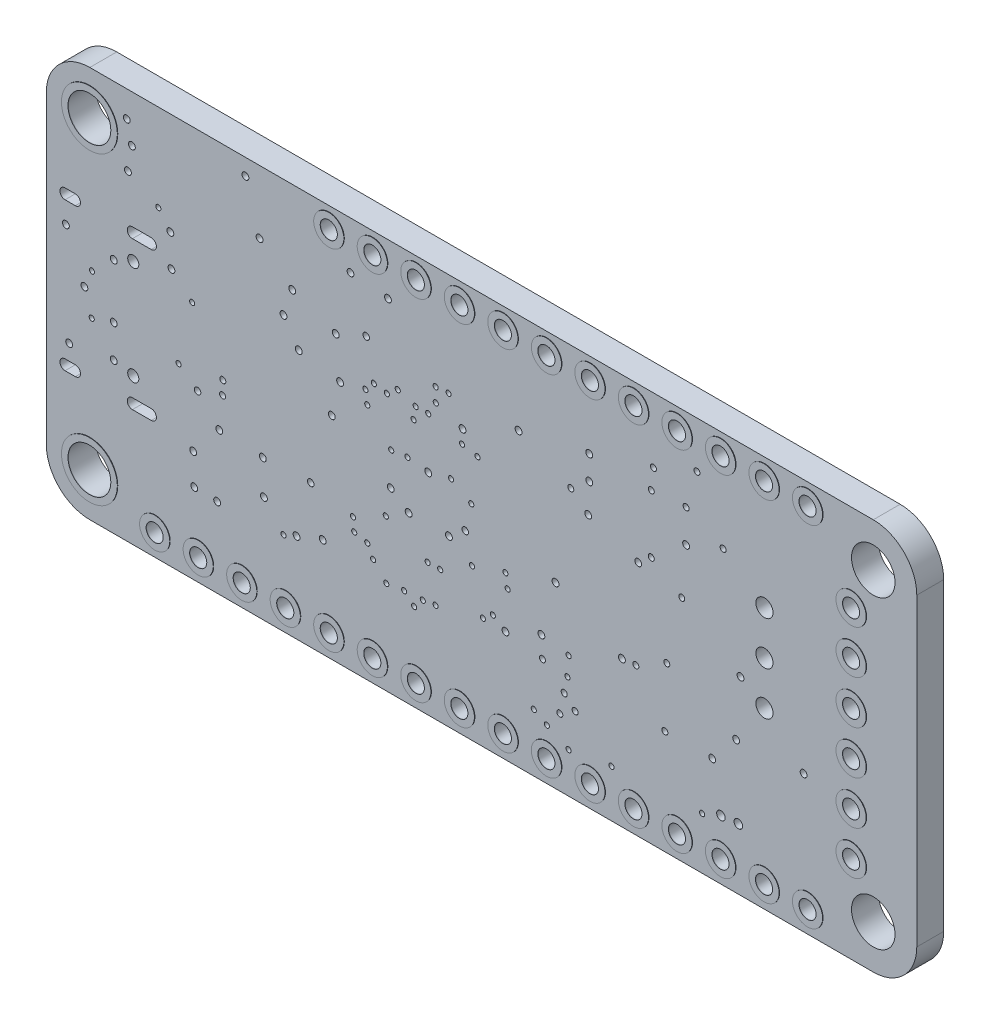
from build123d import *

# Parameters (mm, degrees)
SKETCH1_R              = 1.27
SKETCH1_R_2            = 0.5
SKETCH1_R_3            = 0.325
SKETCH1_R_4            = 1.25
SKETCH1_R_5            = 0.175
SKETCH1_R_6            = 0.15
SKETCH1_R_7            = 0.197
SKETCH1_R_8            = 0.1905
SKETCH1_R_9            = 0.2
SKETCH1_R_10           = 0.25
BOSS_EXTRUDE1_DEPTH    = 1.57
SKETCH2_R              = 0.881
SKETCH2_R_2            = 0.5
BOSS_EXTRUDE2_DEPTH    = 0.0254
BOSS_EXTRUDE2_2_DEPTH  = 0.0254
BOSS_EXTRUDE2_3_DEPTH  = 0.0254
BOSS_EXTRUDE2_4_DEPTH  = 0.0254
BOSS_EXTRUDE2_5_DEPTH  = 0.0254
BOSS_EXTRUDE2_6_DEPTH  = 0.0254
BOSS_EXTRUDE2_7_DEPTH  = 0.0254
BOSS_EXTRUDE2_8_DEPTH  = 0.0254
BOSS_EXTRUDE2_9_DEPTH  = 0.0254
BOSS_EXTRUDE2_10_DEPTH = 0.0254
BOSS_EXTRUDE2_11_DEPTH = 0.0254
BOSS_EXTRUDE2_12_DEPTH = 0.0254
BOSS_EXTRUDE2_13_DEPTH = 0.0254
BOSS_EXTRUDE2_14_DEPTH = 0.0254
BOSS_EXTRUDE2_15_DEPTH = 0.0254
BOSS_EXTRUDE2_16_DEPTH = 0.0254
BOSS_EXTRUDE2_17_DEPTH = 0.0254
BOSS_EXTRUDE2_18_DEPTH = 0.0254
BOSS_EXTRUDE2_19_DEPTH = 0.0254
BOSS_EXTRUDE2_20_DEPTH = 0.0254
BOSS_EXTRUDE2_21_DEPTH = 0.0254
BOSS_EXTRUDE2_22_DEPTH = 0.0254
BOSS_EXTRUDE2_23_DEPTH = 0.0254
BOSS_EXTRUDE2_24_DEPTH = 0.0254
BOSS_EXTRUDE2_25_DEPTH = 0.0254
BOSS_EXTRUDE2_26_DEPTH = 0.0254
BOSS_EXTRUDE2_27_DEPTH = 0.0254
BOSS_EXTRUDE2_28_DEPTH = 0.0254
BOSS_EXTRUDE2_29_DEPTH = 0.0254
BOSS_EXTRUDE2_30_DEPTH = 0.0254
BOSS_EXTRUDE2_31_DEPTH = 0.0254
BOSS_EXTRUDE2_32_DEPTH = 0.0254
BOSS_EXTRUDE2_33_DEPTH = 0.0254
BOSS_EXTRUDE2_34_DEPTH = 0.0254
SKETCH2_R_3            = 1.631
SKETCH2_R_4            = 1.25
BOSS_EXTRUDE2_35_DEPTH = 0.0254
BOSS_EXTRUDE2_36_DEPTH = 0.0254


with BuildPart() as part:
    # Sketch1 → Boss-Extrude1 (new body)
    with BuildSketch(Plane(origin=(0, 0, 0), x_dir=(-1, 0, 0), z_dir=(0, 0, -1))):
        with BuildLine():
            Line((0, 2.54), (0, 20.32))
            ThreePointArc((0, 20.32), (-0.743948776, 22.116051224), (-2.54, 22.86))
            Line((-2.54, 22.86), (-48.26, 22.86))
            ThreePointArc((-48.26, 22.86), (-50.056051224, 22.116051224), (-50.8, 20.32))
            Line((-50.8, 20.32), (-50.8, 2.54))
            ThreePointArc((-50.8, 2.54), (-50.056051224, 0.743948776), (-48.26, 0))
            Line((-48.26, 0), (-2.54, 0))
            ThreePointArc((-2.54, 0), (-0.743948776, 0.743948776), (0, 2.54))
        make_face()
        with Locations((-48.26, 2.54)):
            Circle(SKETCH1_R, mode=Mode.SUBTRACT)
        with Locations((-48.26, 20.32)):
            Circle(SKETCH1_R, mode=Mode.SUBTRACT)
        with Locations((-41.91, 15.24)):
            Circle(SKETCH1_R_2, mode=Mode.SUBTRACT)
        with Locations((-41.91, 10.16)):
            Circle(SKETCH1_R_2, mode=Mode.SUBTRACT)
        with Locations((-46.99, 7.62)):
            Circle(SKETCH1_R_2, mode=Mode.SUBTRACT)
        with Locations((-46.99, 12.7)):
            Circle(SKETCH1_R_2, mode=Mode.SUBTRACT)
        with Locations((-46.99, 17.78)):
            Circle(SKETCH1_R_2, mode=Mode.SUBTRACT)
        with Locations((-5.074, 8.54)):
            Circle(SKETCH1_R_3, mode=Mode.SUBTRACT)
        with Locations((-41.91, 21.654)):
            Circle(SKETCH1_R_2, mode=Mode.SUBTRACT)
        with Locations((-36.83, 21.654)):
            Circle(SKETCH1_R_2, mode=Mode.SUBTRACT)
        with Locations((-31.75, 21.654)):
            Circle(SKETCH1_R_2, mode=Mode.SUBTRACT)
        with Locations((-26.67, 21.654)):
            Circle(SKETCH1_R_2, mode=Mode.SUBTRACT)
        with Locations((-21.59, 21.654)):
            Circle(SKETCH1_R_2, mode=Mode.SUBTRACT)
        with Locations((-16.51, 21.654)):
            Circle(SKETCH1_R_2, mode=Mode.SUBTRACT)
        with Locations((-8.89, 1.27)):
            Circle(SKETCH1_R_2, mode=Mode.SUBTRACT)
        with Locations((-13.97, 1.27)):
            Circle(SKETCH1_R_2, mode=Mode.SUBTRACT)
        with Locations((-19.05, 1.27)):
            Circle(SKETCH1_R_2, mode=Mode.SUBTRACT)
        with Locations((-24.13, 1.27)):
            Circle(SKETCH1_R_2, mode=Mode.SUBTRACT)
        with Locations((-29.21, 1.27)):
            Circle(SKETCH1_R_2, mode=Mode.SUBTRACT)
        with Locations((-34.29, 1.27)):
            Circle(SKETCH1_R_2, mode=Mode.SUBTRACT)
        with Locations((-39.37, 1.27)):
            Circle(SKETCH1_R_2, mode=Mode.SUBTRACT)
        with Locations((-44.45, 1.27)):
            Circle(SKETCH1_R_2, mode=Mode.SUBTRACT)
        with Locations((-2.54, 20.32)):
            Circle(SKETCH1_R_4, mode=Mode.SUBTRACT)
        with Locations((-37.084, 13.335)):
            Circle(SKETCH1_R_5, mode=Mode.SUBTRACT)
        with Locations((-30.416, 5.997)):
            Circle(SKETCH1_R_6, mode=Mode.SUBTRACT)
        with Locations((-30.861, 4.488)):
            Circle(SKETCH1_R_5, mode=Mode.SUBTRACT)
        with Locations((-29.969, 3.92)):
            Circle(SKETCH1_R_5, mode=Mode.SUBTRACT)
        with Locations((-36.101, 6.087)):
            Circle(SKETCH1_R_5, mode=Mode.SUBTRACT)
        with Locations((-17.97, 7.099)):
            Circle(SKETCH1_R_6, mode=Mode.SUBTRACT)
        with Locations((-18.732, 6.922)):
            Circle(SKETCH1_R_6, mode=Mode.SUBTRACT)
        with Locations((-17.9, 7.831)):
            Circle(SKETCH1_R_6, mode=Mode.SUBTRACT)
        with Locations((-21.971, 5.652)):
            Circle(SKETCH1_R_6, mode=Mode.SUBTRACT)
        with Locations((-39.497, 17.018)):
            Circle(SKETCH1_R_5, mode=Mode.SUBTRACT)
        with Locations((-30.223, 5.083)):
            Circle(SKETCH1_R_5, mode=Mode.SUBTRACT)
        with Locations((-13.843, 4.89)):
            Circle(SKETCH1_R_6, mode=Mode.SUBTRACT)
        with Locations((-2.667, 12.636)):
            Circle(SKETCH1_R_6, mode=Mode.SUBTRACT)
        with Locations((-26.06, 6.947)):
            Circle(SKETCH1_R_6, mode=Mode.SUBTRACT)
        with Locations((-24.259, 14.685)):
            Circle(SKETCH1_R_6, mode=Mode.SUBTRACT)
        with Locations((-24.846, 8.826)):
            Circle(SKETCH1_R_6, mode=Mode.SUBTRACT)
        with Locations((-28.956, 6.167)):
            Circle(SKETCH1_R_5, mode=Mode.SUBTRACT)
        with Locations((-32.984, 2.766)):
            Circle(SKETCH1_R_6, mode=Mode.SUBTRACT)
        with Locations((-23.622, 12.609)):
            Circle(SKETCH1_R_6, mode=Mode.SUBTRACT)
        with Locations((-22.72, 5.766)):
            Circle(SKETCH1_R_6, mode=Mode.SUBTRACT)
        with Locations((-4.699, 21.336)):
            Circle(SKETCH1_R_7, mode=Mode.SUBTRACT)
        with Locations((-26.924, 8.694)):
            Circle(SKETCH1_R_6, mode=Mode.SUBTRACT)
        with Locations((-26.792, 9.452)):
            Circle(SKETCH1_R_6, mode=Mode.SUBTRACT)
        with Locations((-22.728, 16.002)):
            Circle(SKETCH1_R_6, mode=Mode.SUBTRACT)
        with Locations((-20.51, 15.558)):
            Circle(SKETCH1_R_6, mode=Mode.SUBTRACT)
        with Locations((-23.479, 16.86)):
            Circle(SKETCH1_R_6, mode=Mode.SUBTRACT)
        with Locations((-37.338, 18.034)):
            Circle(SKETCH1_R_5, mode=Mode.SUBTRACT)
        with Locations((-22.722, 16.814)):
            Circle(SKETCH1_R_6, mode=Mode.SUBTRACT)
        with Locations((-18.732, 13.906)):
            Circle(SKETCH1_R_6, mode=Mode.SUBTRACT)
        with Locations((-18.669, 17.336)):
            Circle(SKETCH1_R_8, mode=Mode.SUBTRACT)
        with Locations((-4.762, 18.732)):
            Circle(SKETCH1_R_9, mode=Mode.SUBTRACT)
        with Locations((-3.937, 8.763)):
            Circle(SKETCH1_R_9, mode=Mode.SUBTRACT)
        with Locations((-35.306, 14.478)):
            Circle(SKETCH1_R_5, mode=Mode.SUBTRACT)
        with Locations((-24.29, 15.466)):
            Circle(SKETCH1_R_9, mode=Mode.SUBTRACT)
        with Locations((-15.43, 8.318)):
            Circle(SKETCH1_R_8, mode=Mode.SUBTRACT)
        with Locations((-16.662, 12.333)):
            Circle(SKETCH1_R_7, mode=Mode.SUBTRACT)
        with Locations((-19.114, 15.176)):
            Circle(SKETCH1_R_6, mode=Mode.SUBTRACT)
        with Locations((-22.255, 7.711)):
            Circle(SKETCH1_R_6, mode=Mode.SUBTRACT)
        with Locations((-21.553, 15.233)):
            Circle(SKETCH1_R_6, mode=Mode.SUBTRACT)
        with Locations((-44.196, 8.001)):
            Circle(SKETCH1_R_9, mode=Mode.SUBTRACT)
        with Locations((-40.513, 11.049)):
            Circle(SKETCH1_R_9, mode=Mode.SUBTRACT)
        with Locations((-26.797, 6.477)):
            Circle(SKETCH1_R_9, mode=Mode.SUBTRACT)
        with Locations((-37.338, 16.129)):
            Circle(SKETCH1_R_9, mode=Mode.SUBTRACT)
        with Locations((-38.862, 6.096)):
            Circle(SKETCH1_R_9, mode=Mode.SUBTRACT)
        with Locations((-31.686, 17.907)):
            Circle(SKETCH1_R_9, mode=Mode.SUBTRACT)
        with Locations((-31.623, 14.796)):
            Circle(SKETCH1_R_9, mode=Mode.SUBTRACT)
        with Locations((-12.446, 19.177)):
            Circle(SKETCH1_R_9, mode=Mode.SUBTRACT)
        with Locations((-7.302, 15.05)):
            Circle(SKETCH1_R_9, mode=Mode.SUBTRACT)
        with Locations((-1.143, 14.224)):
            Circle(SKETCH1_R_9, mode=Mode.SUBTRACT)
        with Locations((-2.222, 11.62)):
            Circle(SKETCH1_R_9, mode=Mode.SUBTRACT)
        with Locations((-14.605, 5.207)):
            Circle(SKETCH1_R_9, mode=Mode.SUBTRACT)
        with Locations((-14.732, 14.668)):
            Circle(SKETCH1_R_9, mode=Mode.SUBTRACT)
        with Locations((-12.636, 8.192)):
            Circle(SKETCH1_R_9, mode=Mode.SUBTRACT)
        with Locations((-16.891, 16.574)):
            Circle(SKETCH1_R_9, mode=Mode.SUBTRACT)
        with Locations((-28.892, 7.366)):
            Circle(SKETCH1_R_9, mode=Mode.SUBTRACT)
        with Locations((-23.495, 9.652)):
            Circle(SKETCH1_R_9, mode=Mode.SUBTRACT)
        with Locations((-12.7, 6.223)):
            Circle(SKETCH1_R_9, mode=Mode.SUBTRACT)
        with Locations((-8.572, 6.477)):
            Circle(SKETCH1_R_9, mode=Mode.SUBTRACT)
        with Locations((-4.995, 20.13)):
            Circle(SKETCH1_R_9, mode=Mode.SUBTRACT)
        with Locations((-10.096, 8.318)):
            Circle(SKETCH1_R_9, mode=Mode.SUBTRACT)
        with Locations((-9.97, 4.636)):
            Circle(SKETCH1_R_9, mode=Mode.SUBTRACT)
        with Locations((-16.129, 5.778)):
            Circle(SKETCH1_R_9, mode=Mode.SUBTRACT)
        with Locations((-21.146, 9.652)):
            Circle(SKETCH1_R_9, mode=Mode.SUBTRACT)
        with Locations((-13.843, 16.002)):
            Circle(SKETCH1_R_9, mode=Mode.SUBTRACT)
        with Locations((-27.559, 17.018)):
            Circle(SKETCH1_R_9, mode=Mode.SUBTRACT)
        with Locations((-17.145, 14.262)):
            Circle(SKETCH1_R_9, mode=Mode.SUBTRACT)
        with Locations((-8.636, 4.699)):
            Circle(SKETCH1_R_9, mode=Mode.SUBTRACT)
        with Locations((-22.288, 12.268)):
            Circle(SKETCH1_R_9, mode=Mode.SUBTRACT)
        with Locations((-1.334, 8.318)):
            Circle(SKETCH1_R_9, mode=Mode.SUBTRACT)
        with Locations((-7.239, 16.891)):
            Circle(SKETCH1_R_9, mode=Mode.SUBTRACT)
        with Locations((-19.939, 19.876)):
            Circle(SKETCH1_R_9, mode=Mode.SUBTRACT)
        with Locations((-14.351, 17.526)):
            Circle(SKETCH1_R_9, mode=Mode.SUBTRACT)
        with Locations((-31.686, 16.51)):
            Circle(SKETCH1_R_9, mode=Mode.SUBTRACT)
        with Locations((-29.718, 10.414)):
            Circle(SKETCH1_R_9, mode=Mode.SUBTRACT)
        with Locations((-40.386, 3.556)):
            Circle(SKETCH1_R_10, mode=Mode.SUBTRACT)
        with Locations((-33.592, 8.509)):
            Circle(SKETCH1_R_9, mode=Mode.SUBTRACT)
        with Locations((-34.544, 13.843)):
            Circle(SKETCH1_R_9, mode=Mode.SUBTRACT)
        with Locations((-40.259, 7.747)):
            Circle(SKETCH1_R_9, mode=Mode.SUBTRACT)
        with Locations((-20.13, 12.319)):
            Circle(SKETCH1_R_6, mode=Mode.SUBTRACT)
        with Locations((-21.077, 12.429)):
            Circle(SKETCH1_R_6, mode=Mode.SUBTRACT)
        with Locations((-25.477, 6.496)):
            Circle(SKETCH1_R_6, mode=Mode.SUBTRACT)
        with Locations((-18.624, 14.631)):
            Circle(SKETCH1_R_6, mode=Mode.SUBTRACT)
        with Locations((-20.098, 10.382)):
            Circle(SKETCH1_R_7, mode=Mode.SUBTRACT)
        with Locations((-24.447, 10.401)):
            Circle(SKETCH1_R_8, mode=Mode.SUBTRACT)
        with Locations((-30.607, 15.629)):
            Circle(SKETCH1_R_5, mode=Mode.SUBTRACT)
        with Locations((-3.937, 13.843)):
            Circle(SKETCH1_R_9, mode=Mode.SUBTRACT)
        with Locations((-3.937, 10.668)):
            Circle(SKETCH1_R_9, mode=Mode.SUBTRACT)
        with Locations((-8.826, 9.652)):
            Circle(SKETCH1_R_8, mode=Mode.SUBTRACT)
        with Locations((-10.302, 10.942)):
            Circle(SKETCH1_R_5, mode=Mode.SUBTRACT)
        with Locations((-6.54, 17.78)):
            Circle(SKETCH1_R_6, mode=Mode.SUBTRACT)
        with Locations((-35.306, 17.872)):
            Circle(SKETCH1_R_5, mode=Mode.SUBTRACT)
        with Locations((-37.973, 20.152)):
            Circle(SKETCH1_R_5, mode=Mode.SUBTRACT)
        with Locations((-35.433, 19.075)):
            Circle(SKETCH1_R_5, mode=Mode.SUBTRACT)
        with Locations((-22.288, 15.24)):
            Circle(SKETCH1_R_6, mode=Mode.SUBTRACT)
        with Locations((-19.876, 15.05)):
            Circle(SKETCH1_R_6, mode=Mode.SUBTRACT)
        with Locations((-7.722, 10.478)):
            Circle(SKETCH1_R_6, mode=Mode.SUBTRACT)
        with Locations((-8.509, 13.97)):
            Circle(SKETCH1_R_6, mode=Mode.SUBTRACT)
        with Locations((-17.753, 20.093)):
            Circle(SKETCH1_R_7, mode=Mode.SUBTRACT)
        with Locations((-24.801, 11.938)):
            Circle(SKETCH1_R_6, mode=Mode.SUBTRACT)
        with Locations((-11.62, 21.908)):
            Circle(SKETCH1_R_9, mode=Mode.SUBTRACT)
        with Locations((-38.269, 3.02)):
            Circle(SKETCH1_R_6, mode=Mode.SUBTRACT)
        with Locations((-19.812, 8.826)):
            Circle(SKETCH1_R_6, mode=Mode.SUBTRACT)
        with Locations((-25.163, 14.502)):
            Circle(SKETCH1_R_6, mode=Mode.SUBTRACT)
        with Locations((-22.987, 7.711)):
            Circle(SKETCH1_R_6, mode=Mode.SUBTRACT)
        with Locations((-2.65, 10.24)):
            Circle(SKETCH1_R_6, mode=Mode.SUBTRACT)
        with Locations((-21.432, 14.506)):
            Circle(SKETCH1_R_6, mode=Mode.SUBTRACT)
        with Locations((-20.884, 5.588)):
            Circle(SKETCH1_R_6, mode=Mode.SUBTRACT)
        with Locations((-36.21, 9.588)):
            Circle(SKETCH1_R_5, mode=Mode.SUBTRACT)
        with Locations((-39.37, 3.463)):
            Circle(SKETCH1_R_10, mode=Mode.SUBTRACT)
        with Locations((-30.48, 7.112)):
            Circle(SKETCH1_R_6, mode=Mode.SUBTRACT)
        with Locations((-30.48, 2.35)):
            Circle(SKETCH1_R_6, mode=Mode.SUBTRACT)
        with Locations((-28.448, 3.373)):
            Circle(SKETCH1_R_6, mode=Mode.SUBTRACT)
        with Locations((-29.21, 2.957)):
            Circle(SKETCH1_R_6, mode=Mode.SUBTRACT)
        with Locations((-19.071, 6.262)):
            Circle(SKETCH1_R_6, mode=Mode.SUBTRACT)
        with Locations((-19.842, 5.434)):
            Circle(SKETCH1_R_6, mode=Mode.SUBTRACT)
        with Locations((-21.463, 5.08)):
            Circle(SKETCH1_R_6, mode=Mode.SUBTRACT)
        with Locations((-34.406, 8.583)):
            Circle(SKETCH1_R_5, mode=Mode.SUBTRACT)
        with Locations((-10.287, 10.16)):
            Circle(SKETCH1_R_5, mode=Mode.SUBTRACT)
        with Locations((-2.54, 2.54)):
            Circle(SKETCH1_R_4, mode=Mode.SUBTRACT)
        with Locations((-41.91, 1.27)):
            Circle(SKETCH1_R_2, mode=Mode.SUBTRACT)
        with Locations((-36.83, 1.27)):
            Circle(SKETCH1_R_2, mode=Mode.SUBTRACT)
        with Locations((-31.75, 1.27)):
            Circle(SKETCH1_R_2, mode=Mode.SUBTRACT)
        with Locations((-26.67, 1.27)):
            Circle(SKETCH1_R_2, mode=Mode.SUBTRACT)
        with Locations((-21.59, 1.27)):
            Circle(SKETCH1_R_2, mode=Mode.SUBTRACT)
        with Locations((-16.51, 1.27)):
            Circle(SKETCH1_R_2, mode=Mode.SUBTRACT)
        with Locations((-11.43, 1.27)):
            Circle(SKETCH1_R_2, mode=Mode.SUBTRACT)
        with Locations((-6.35, 1.27)):
            Circle(SKETCH1_R_2, mode=Mode.SUBTRACT)
        with Locations((-19.05, 21.654)):
            Circle(SKETCH1_R_2, mode=Mode.SUBTRACT)
        with Locations((-24.13, 21.654)):
            Circle(SKETCH1_R_2, mode=Mode.SUBTRACT)
        with Locations((-29.21, 21.654)):
            Circle(SKETCH1_R_2, mode=Mode.SUBTRACT)
        with Locations((-34.29, 21.654)):
            Circle(SKETCH1_R_2, mode=Mode.SUBTRACT)
        with Locations((-39.37, 21.654)):
            Circle(SKETCH1_R_2, mode=Mode.SUBTRACT)
        with Locations((-44.45, 21.654)):
            Circle(SKETCH1_R_2, mode=Mode.SUBTRACT)
        with Locations((-5.074, 14.32)):
            Circle(SKETCH1_R_3, mode=Mode.SUBTRACT)
        with Locations((-46.99, 15.24)):
            Circle(SKETCH1_R_2, mode=Mode.SUBTRACT)
        with Locations((-46.99, 10.16)):
            Circle(SKETCH1_R_2, mode=Mode.SUBTRACT)
        with Locations((-46.99, 5.08)):
            Circle(SKETCH1_R_2, mode=Mode.SUBTRACT)
        with Locations((-41.91, 12.7)):
            Circle(SKETCH1_R_2, mode=Mode.SUBTRACT)
        with BuildLine():
            Line((-5.024, 6.81), (-6.124, 6.81))
            ThreePointArc((-6.124, 6.81), (-6.424, 7.11), (-6.124, 7.41))
            Line((-6.124, 7.41), (-5.024, 7.41))
            ThreePointArc((-5.024, 7.41), (-4.724, 7.11), (-5.024, 6.81))
        make_face(mode=Mode.SUBTRACT)
        with BuildLine():
            Line((-1.694, 16.05), (-1.094, 16.05))
            ThreePointArc((-1.094, 16.05), (-0.794, 15.75), (-1.094, 15.45))
            Line((-1.094, 15.45), (-1.694, 15.45))
            ThreePointArc((-1.694, 15.45), (-1.994, 15.75), (-1.694, 16.05))
        make_face(mode=Mode.SUBTRACT)
        with BuildLine():
            Line((-5.024, 15.45), (-6.124, 15.45))
            ThreePointArc((-6.124, 15.45), (-6.424, 15.75), (-6.124, 16.05))
            Line((-6.124, 16.05), (-5.024, 16.05))
            ThreePointArc((-5.024, 16.05), (-4.724, 15.75), (-5.024, 15.45))
        make_face(mode=Mode.SUBTRACT)
        with BuildLine():
            Line((-1.094, 6.81), (-1.694, 6.81))
            ThreePointArc((-1.694, 6.81), (-1.994, 7.11), (-1.694, 7.41))
            Line((-1.694, 7.41), (-1.094, 7.41))
            ThreePointArc((-1.094, 7.41), (-0.794, 7.11), (-1.094, 6.81))
        make_face(mode=Mode.SUBTRACT)
    extrude(amount=-BOSS_EXTRUDE1_DEPTH)


with BuildPart() as body_2:
    # Sketch2 → Boss-Extrude2 (new body)
    with BuildSketch(Plane.XY.offset(1.57)):
        with Locations((46.99, 5.08)):
            Circle(SKETCH2_R)
        with Locations((46.99, 5.08)):
            Circle(SKETCH2_R_2, mode=Mode.SUBTRACT)
    boss_extrude2 = extrude(amount=BOSS_EXTRUDE2_DEPTH)


with BuildPart() as body_3:
    # Sketch2 → Boss-Extrude2 2 (new body)
    with BuildSketch(Plane.XY.offset(1.57)):
        with Locations((46.99, 7.62)):
            Circle(SKETCH2_R)
        with Locations((46.99, 7.62)):
            Circle(SKETCH2_R_2, mode=Mode.SUBTRACT)
    boss_extrude2_2 = extrude(amount=BOSS_EXTRUDE2_2_DEPTH)


with BuildPart() as body_4:
    # Sketch2 → Boss-Extrude2 3 (new body)
    with BuildSketch(Plane.XY.offset(1.57)):
        with Locations((46.99, 10.16)):
            Circle(SKETCH2_R)
        with Locations((46.99, 10.16)):
            Circle(SKETCH2_R_2, mode=Mode.SUBTRACT)
    boss_extrude2_3 = extrude(amount=BOSS_EXTRUDE2_3_DEPTH)


with BuildPart() as body_5:
    # Sketch2 → Boss-Extrude2 4 (new body)
    with BuildSketch(Plane.XY.offset(1.57)):
        with Locations((46.99, 12.7)):
            Circle(SKETCH2_R)
        with Locations((46.99, 12.7)):
            Circle(SKETCH2_R_2, mode=Mode.SUBTRACT)
    boss_extrude2_4 = extrude(amount=BOSS_EXTRUDE2_4_DEPTH)


with BuildPart() as body_6:
    # Sketch2 → Boss-Extrude2 5 (new body)
    with BuildSketch(Plane.XY.offset(1.57)):
        with Locations((46.99, 15.24)):
            Circle(SKETCH2_R)
        with Locations((46.99, 15.24)):
            Circle(SKETCH2_R_2, mode=Mode.SUBTRACT)
    boss_extrude2_5 = extrude(amount=BOSS_EXTRUDE2_5_DEPTH)


with BuildPart() as body_7:
    # Sketch2 → Boss-Extrude2 6 (new body)
    with BuildSketch(Plane.XY.offset(1.57)):
        with Locations((46.99, 17.78)):
            Circle(SKETCH2_R)
        with Locations((46.99, 17.78)):
            Circle(SKETCH2_R_2, mode=Mode.SUBTRACT)
    boss_extrude2_6 = extrude(amount=BOSS_EXTRUDE2_6_DEPTH)


with BuildPart() as body_8:
    # Sketch2 → Boss-Extrude2 7 (new body)
    with BuildSketch(Plane.XY.offset(1.57)):
        with Locations((44.45, 1.27)):
            Circle(SKETCH2_R)
        with Locations((44.45, 1.27)):
            Circle(SKETCH2_R_2, mode=Mode.SUBTRACT)
    boss_extrude2_7 = extrude(amount=BOSS_EXTRUDE2_7_DEPTH)


with BuildPart() as body_9:
    # Sketch2 → Boss-Extrude2 8 (new body)
    with BuildSketch(Plane.XY.offset(1.57)):
        with Locations((41.91, 1.27)):
            Circle(SKETCH2_R)
        with Locations((41.91, 1.27)):
            Circle(SKETCH2_R_2, mode=Mode.SUBTRACT)
    boss_extrude2_8 = extrude(amount=BOSS_EXTRUDE2_8_DEPTH)


with BuildPart() as body_10:
    # Sketch2 → Boss-Extrude2 9 (new body)
    with BuildSketch(Plane.XY.offset(1.57)):
        with Locations((39.37, 1.27)):
            Circle(SKETCH2_R)
        with Locations((39.37, 1.27)):
            Circle(SKETCH2_R_2, mode=Mode.SUBTRACT)
    boss_extrude2_9 = extrude(amount=BOSS_EXTRUDE2_9_DEPTH)


with BuildPart() as body_11:
    # Sketch2 → Boss-Extrude2 10 (new body)
    with BuildSketch(Plane.XY.offset(1.57)):
        with Locations((36.83, 1.27)):
            Circle(SKETCH2_R)
        with Locations((36.83, 1.27)):
            Circle(SKETCH2_R_2, mode=Mode.SUBTRACT)
    boss_extrude2_10 = extrude(amount=BOSS_EXTRUDE2_10_DEPTH)


with BuildPart() as body_12:
    # Sketch2 → Boss-Extrude2 11 (new body)
    with BuildSketch(Plane.XY.offset(1.57)):
        with Locations((34.29, 1.27)):
            Circle(SKETCH2_R)
        with Locations((34.29, 1.27)):
            Circle(SKETCH2_R_2, mode=Mode.SUBTRACT)
    boss_extrude2_11 = extrude(amount=BOSS_EXTRUDE2_11_DEPTH)


with BuildPart() as body_13:
    # Sketch2 → Boss-Extrude2 12 (new body)
    with BuildSketch(Plane.XY.offset(1.57)):
        with Locations((31.75, 1.27)):
            Circle(SKETCH2_R)
        with Locations((31.75, 1.27)):
            Circle(SKETCH2_R_2, mode=Mode.SUBTRACT)
    boss_extrude2_12 = extrude(amount=BOSS_EXTRUDE2_12_DEPTH)


with BuildPart() as body_14:
    # Sketch2 → Boss-Extrude2 13 (new body)
    with BuildSketch(Plane.XY.offset(1.57)):
        with Locations((29.21, 1.27)):
            Circle(SKETCH2_R)
        with Locations((29.21, 1.27)):
            Circle(SKETCH2_R_2, mode=Mode.SUBTRACT)
    boss_extrude2_13 = extrude(amount=BOSS_EXTRUDE2_13_DEPTH)


with BuildPart() as body_15:
    # Sketch2 → Boss-Extrude2 14 (new body)
    with BuildSketch(Plane.XY.offset(1.57)):
        with Locations((26.67, 1.27)):
            Circle(SKETCH2_R)
        with Locations((26.67, 1.27)):
            Circle(SKETCH2_R_2, mode=Mode.SUBTRACT)
    boss_extrude2_14 = extrude(amount=BOSS_EXTRUDE2_14_DEPTH)


with BuildPart() as body_16:
    # Sketch2 → Boss-Extrude2 15 (new body)
    with BuildSketch(Plane.XY.offset(1.57)):
        with Locations((24.13, 1.27)):
            Circle(SKETCH2_R)
        with Locations((24.13, 1.27)):
            Circle(SKETCH2_R_2, mode=Mode.SUBTRACT)
    boss_extrude2_15 = extrude(amount=BOSS_EXTRUDE2_15_DEPTH)


with BuildPart() as body_17:
    # Sketch2 → Boss-Extrude2 16 (new body)
    with BuildSketch(Plane.XY.offset(1.57)):
        with Locations((21.59, 1.27)):
            Circle(SKETCH2_R)
        with Locations((21.59, 1.27)):
            Circle(SKETCH2_R_2, mode=Mode.SUBTRACT)
    boss_extrude2_16 = extrude(amount=BOSS_EXTRUDE2_16_DEPTH)


with BuildPart() as body_18:
    # Sketch2 → Boss-Extrude2 17 (new body)
    with BuildSketch(Plane.XY.offset(1.57)):
        with Locations((19.05, 1.27)):
            Circle(SKETCH2_R)
        with Locations((19.05, 1.27)):
            Circle(SKETCH2_R_2, mode=Mode.SUBTRACT)
    boss_extrude2_17 = extrude(amount=BOSS_EXTRUDE2_17_DEPTH)


with BuildPart() as body_19:
    # Sketch2 → Boss-Extrude2 18 (new body)
    with BuildSketch(Plane.XY.offset(1.57)):
        with Locations((16.51, 1.27)):
            Circle(SKETCH2_R)
        with Locations((16.51, 1.27)):
            Circle(SKETCH2_R_2, mode=Mode.SUBTRACT)
    boss_extrude2_18 = extrude(amount=BOSS_EXTRUDE2_18_DEPTH)


with BuildPart() as body_20:
    # Sketch2 → Boss-Extrude2 19 (new body)
    with BuildSketch(Plane.XY.offset(1.57)):
        with Locations((13.97, 1.27)):
            Circle(SKETCH2_R)
        with Locations((13.97, 1.27)):
            Circle(SKETCH2_R_2, mode=Mode.SUBTRACT)
    boss_extrude2_19 = extrude(amount=BOSS_EXTRUDE2_19_DEPTH)


with BuildPart() as body_21:
    # Sketch2 → Boss-Extrude2 20 (new body)
    with BuildSketch(Plane.XY.offset(1.57)):
        with Locations((11.43, 1.27)):
            Circle(SKETCH2_R)
        with Locations((11.43, 1.27)):
            Circle(SKETCH2_R_2, mode=Mode.SUBTRACT)
    boss_extrude2_20 = extrude(amount=BOSS_EXTRUDE2_20_DEPTH)


with BuildPart() as body_22:
    # Sketch2 → Boss-Extrude2 21 (new body)
    with BuildSketch(Plane.XY.offset(1.57)):
        with Locations((8.89, 1.27)):
            Circle(SKETCH2_R)
        with Locations((8.89, 1.27)):
            Circle(SKETCH2_R_2, mode=Mode.SUBTRACT)
    boss_extrude2_21 = extrude(amount=BOSS_EXTRUDE2_21_DEPTH)


with BuildPart() as body_23:
    # Sketch2 → Boss-Extrude2 22 (new body)
    with BuildSketch(Plane.XY.offset(1.57)):
        with Locations((6.35, 1.27)):
            Circle(SKETCH2_R)
        with Locations((6.35, 1.27)):
            Circle(SKETCH2_R_2, mode=Mode.SUBTRACT)
    boss_extrude2_22 = extrude(amount=BOSS_EXTRUDE2_22_DEPTH)


with BuildPart() as body_24:
    # Sketch2 → Boss-Extrude2 23 (new body)
    with BuildSketch(Plane.XY.offset(1.57)):
        with Locations((44.45, 21.654)):
            Circle(SKETCH2_R)
        with Locations((44.45, 21.654)):
            Circle(SKETCH2_R_2, mode=Mode.SUBTRACT)
    boss_extrude2_23 = extrude(amount=BOSS_EXTRUDE2_23_DEPTH)


with BuildPart() as body_25:
    # Sketch2 → Boss-Extrude2 24 (new body)
    with BuildSketch(Plane.XY.offset(1.57)):
        with Locations((41.91, 21.654)):
            Circle(SKETCH2_R)
        with Locations((41.91, 21.654)):
            Circle(SKETCH2_R_2, mode=Mode.SUBTRACT)
    boss_extrude2_24 = extrude(amount=BOSS_EXTRUDE2_24_DEPTH)


with BuildPart() as body_26:
    # Sketch2 → Boss-Extrude2 25 (new body)
    with BuildSketch(Plane.XY.offset(1.57)):
        with Locations((39.37, 21.654)):
            Circle(SKETCH2_R)
        with Locations((39.37, 21.654)):
            Circle(SKETCH2_R_2, mode=Mode.SUBTRACT)
    boss_extrude2_25 = extrude(amount=BOSS_EXTRUDE2_25_DEPTH)


with BuildPart() as body_27:
    # Sketch2 → Boss-Extrude2 26 (new body)
    with BuildSketch(Plane.XY.offset(1.57)):
        with Locations((36.83, 21.654)):
            Circle(SKETCH2_R)
        with Locations((36.83, 21.654)):
            Circle(SKETCH2_R_2, mode=Mode.SUBTRACT)
    boss_extrude2_26 = extrude(amount=BOSS_EXTRUDE2_26_DEPTH)


with BuildPart() as body_28:
    # Sketch2 → Boss-Extrude2 27 (new body)
    with BuildSketch(Plane.XY.offset(1.57)):
        with Locations((34.29, 21.654)):
            Circle(SKETCH2_R)
        with Locations((34.29, 21.654)):
            Circle(SKETCH2_R_2, mode=Mode.SUBTRACT)
    boss_extrude2_27 = extrude(amount=BOSS_EXTRUDE2_27_DEPTH)


with BuildPart() as body_29:
    # Sketch2 → Boss-Extrude2 28 (new body)
    with BuildSketch(Plane.XY.offset(1.57)):
        with Locations((31.75, 21.654)):
            Circle(SKETCH2_R)
        with Locations((31.75, 21.654)):
            Circle(SKETCH2_R_2, mode=Mode.SUBTRACT)
    boss_extrude2_28 = extrude(amount=BOSS_EXTRUDE2_28_DEPTH)


with BuildPart() as body_30:
    # Sketch2 → Boss-Extrude2 29 (new body)
    with BuildSketch(Plane.XY.offset(1.57)):
        with Locations((29.21, 21.654)):
            Circle(SKETCH2_R)
        with Locations((29.21, 21.654)):
            Circle(SKETCH2_R_2, mode=Mode.SUBTRACT)
    boss_extrude2_29 = extrude(amount=BOSS_EXTRUDE2_29_DEPTH)


with BuildPart() as body_31:
    # Sketch2 → Boss-Extrude2 30 (new body)
    with BuildSketch(Plane.XY.offset(1.57)):
        with Locations((26.67, 21.654)):
            Circle(SKETCH2_R)
        with Locations((26.67, 21.654)):
            Circle(SKETCH2_R_2, mode=Mode.SUBTRACT)
    boss_extrude2_30 = extrude(amount=BOSS_EXTRUDE2_30_DEPTH)


with BuildPart() as body_32:
    # Sketch2 → Boss-Extrude2 31 (new body)
    with BuildSketch(Plane.XY.offset(1.57)):
        with Locations((24.13, 21.654)):
            Circle(SKETCH2_R)
        with Locations((24.13, 21.654)):
            Circle(SKETCH2_R_2, mode=Mode.SUBTRACT)
    boss_extrude2_31 = extrude(amount=BOSS_EXTRUDE2_31_DEPTH)


with BuildPart() as body_33:
    # Sketch2 → Boss-Extrude2 32 (new body)
    with BuildSketch(Plane.XY.offset(1.57)):
        with Locations((21.59, 21.654)):
            Circle(SKETCH2_R)
        with Locations((21.59, 21.654)):
            Circle(SKETCH2_R_2, mode=Mode.SUBTRACT)
    boss_extrude2_32 = extrude(amount=BOSS_EXTRUDE2_32_DEPTH)


with BuildPart() as body_34:
    # Sketch2 → Boss-Extrude2 33 (new body)
    with BuildSketch(Plane.XY.offset(1.57)):
        with Locations((19.05, 21.654)):
            Circle(SKETCH2_R)
        with Locations((19.05, 21.654)):
            Circle(SKETCH2_R_2, mode=Mode.SUBTRACT)
    boss_extrude2_33 = extrude(amount=BOSS_EXTRUDE2_33_DEPTH)


with BuildPart() as body_35:
    # Sketch2 → Boss-Extrude2 34 (new body)
    with BuildSketch(Plane.XY.offset(1.57)):
        with Locations((16.51, 21.654)):
            Circle(SKETCH2_R)
        with Locations((16.51, 21.654)):
            Circle(SKETCH2_R_2, mode=Mode.SUBTRACT)
    boss_extrude2_34 = extrude(amount=BOSS_EXTRUDE2_34_DEPTH)


with BuildPart() as body_36:
    # Sketch2 → Boss-Extrude2 35 (new body)
    with BuildSketch(Plane.XY.offset(1.57)):
        with Locations((2.54, 2.54)):
            Circle(SKETCH2_R_3)
        with Locations((2.54, 2.54)):
            Circle(SKETCH2_R_4, mode=Mode.SUBTRACT)
    boss_extrude2_35 = extrude(amount=BOSS_EXTRUDE2_35_DEPTH)


with BuildPart() as body_37:
    # Sketch2 → Boss-Extrude2 36 (new body)
    with BuildSketch(Plane.XY.offset(1.57)):
        with Locations((2.54, 20.32)):
            Circle(SKETCH2_R_3)
        with Locations((2.54, 20.32)):
            Circle(SKETCH2_R_4, mode=Mode.SUBTRACT)
    boss_extrude2_36 = extrude(amount=BOSS_EXTRUDE2_36_DEPTH)


with BuildPart() as part_1:
    add(part.part)

    # Mirror1: Boss-Extrude2, Boss-Extrude2 2, Boss-Extrude2 3, Boss-Extrude2 4, Boss-Extrude2 5, Boss-Extrude2 6, Boss-Extrude2 7, Boss-Extrude2 8, Boss-Extrude2 9, Boss-Extrude2 10, Boss-Extrude2 11, Boss-Extrude2 12, Boss-Extrude2 13, Boss-Extrude2 14, Boss-Extrude2 15, Boss-Extrude2 16, Boss-Extrude2 17, Boss-Extrude2 18, Boss-Extrude2 19, Boss-Extrude2 20, Boss-Extrude2 21, Boss-Extrude2 22, Boss-Extrude2 23, Boss-Extrude2 24, Boss-Extrude2 25, Boss-Extrude2 26, Boss-Extrude2 27, Boss-Extrude2 28, Boss-Extrude2 29, Boss-Extrude2 30, Boss-Extrude2 31, Boss-Extrude2 32, Boss-Extrude2 33, Boss-Extrude2 34, Boss-Extrude2 35, Boss-Extrude2 36 across plane
    add(boss_extrude2.mirror(Plane(origin=(0, 0, 0.785), x_dir=(1, 0, 0), z_dir=(0, 0, -1))))
    add(boss_extrude2_2.mirror(Plane(origin=(0, 0, 0.785), x_dir=(1, 0, 0), z_dir=(0, 0, -1))))
    add(boss_extrude2_3.mirror(Plane(origin=(0, 0, 0.785), x_dir=(1, 0, 0), z_dir=(0, 0, -1))))
    add(boss_extrude2_4.mirror(Plane(origin=(0, 0, 0.785), x_dir=(1, 0, 0), z_dir=(0, 0, -1))))
    add(boss_extrude2_5.mirror(Plane(origin=(0, 0, 0.785), x_dir=(1, 0, 0), z_dir=(0, 0, -1))))
    add(boss_extrude2_6.mirror(Plane(origin=(0, 0, 0.785), x_dir=(1, 0, 0), z_dir=(0, 0, -1))))
    add(boss_extrude2_7.mirror(Plane(origin=(0, 0, 0.785), x_dir=(1, 0, 0), z_dir=(0, 0, -1))))
    add(boss_extrude2_8.mirror(Plane(origin=(0, 0, 0.785), x_dir=(1, 0, 0), z_dir=(0, 0, -1))))
    add(boss_extrude2_9.mirror(Plane(origin=(0, 0, 0.785), x_dir=(1, 0, 0), z_dir=(0, 0, -1))))
    add(boss_extrude2_10.mirror(Plane(origin=(0, 0, 0.785), x_dir=(1, 0, 0), z_dir=(0, 0, -1))))
    add(boss_extrude2_11.mirror(Plane(origin=(0, 0, 0.785), x_dir=(1, 0, 0), z_dir=(0, 0, -1))))
    add(boss_extrude2_12.mirror(Plane(origin=(0, 0, 0.785), x_dir=(1, 0, 0), z_dir=(0, 0, -1))))
    add(boss_extrude2_13.mirror(Plane(origin=(0, 0, 0.785), x_dir=(1, 0, 0), z_dir=(0, 0, -1))))
    add(boss_extrude2_14.mirror(Plane(origin=(0, 0, 0.785), x_dir=(1, 0, 0), z_dir=(0, 0, -1))))
    add(boss_extrude2_15.mirror(Plane(origin=(0, 0, 0.785), x_dir=(1, 0, 0), z_dir=(0, 0, -1))))
    add(boss_extrude2_16.mirror(Plane(origin=(0, 0, 0.785), x_dir=(1, 0, 0), z_dir=(0, 0, -1))))
    add(boss_extrude2_17.mirror(Plane(origin=(0, 0, 0.785), x_dir=(1, 0, 0), z_dir=(0, 0, -1))))
    add(boss_extrude2_18.mirror(Plane(origin=(0, 0, 0.785), x_dir=(1, 0, 0), z_dir=(0, 0, -1))))
    add(boss_extrude2_19.mirror(Plane(origin=(0, 0, 0.785), x_dir=(1, 0, 0), z_dir=(0, 0, -1))))
    add(boss_extrude2_20.mirror(Plane(origin=(0, 0, 0.785), x_dir=(1, 0, 0), z_dir=(0, 0, -1))))
    add(boss_extrude2_21.mirror(Plane(origin=(0, 0, 0.785), x_dir=(1, 0, 0), z_dir=(0, 0, -1))))
    add(boss_extrude2_22.mirror(Plane(origin=(0, 0, 0.785), x_dir=(1, 0, 0), z_dir=(0, 0, -1))))
    add(boss_extrude2_23.mirror(Plane(origin=(0, 0, 0.785), x_dir=(1, 0, 0), z_dir=(0, 0, -1))))
    add(boss_extrude2_24.mirror(Plane(origin=(0, 0, 0.785), x_dir=(1, 0, 0), z_dir=(0, 0, -1))))
    add(boss_extrude2_25.mirror(Plane(origin=(0, 0, 0.785), x_dir=(1, 0, 0), z_dir=(0, 0, -1))))
    add(boss_extrude2_26.mirror(Plane(origin=(0, 0, 0.785), x_dir=(1, 0, 0), z_dir=(0, 0, -1))))
    add(boss_extrude2_27.mirror(Plane(origin=(0, 0, 0.785), x_dir=(1, 0, 0), z_dir=(0, 0, -1))))
    add(boss_extrude2_28.mirror(Plane(origin=(0, 0, 0.785), x_dir=(1, 0, 0), z_dir=(0, 0, -1))))
    add(boss_extrude2_29.mirror(Plane(origin=(0, 0, 0.785), x_dir=(1, 0, 0), z_dir=(0, 0, -1))))
    add(boss_extrude2_30.mirror(Plane(origin=(0, 0, 0.785), x_dir=(1, 0, 0), z_dir=(0, 0, -1))))
    add(boss_extrude2_31.mirror(Plane(origin=(0, 0, 0.785), x_dir=(1, 0, 0), z_dir=(0, 0, -1))))
    add(boss_extrude2_32.mirror(Plane(origin=(0, 0, 0.785), x_dir=(1, 0, 0), z_dir=(0, 0, -1))))
    add(boss_extrude2_33.mirror(Plane(origin=(0, 0, 0.785), x_dir=(1, 0, 0), z_dir=(0, 0, -1))))
    add(boss_extrude2_34.mirror(Plane(origin=(0, 0, 0.785), x_dir=(1, 0, 0), z_dir=(0, 0, -1))))
    add(boss_extrude2_35.mirror(Plane(origin=(0, 0, 0.785), x_dir=(1, 0, 0), z_dir=(0, 0, -1))))
    add(boss_extrude2_36.mirror(Plane(origin=(0, 0, 0.785), x_dir=(1, 0, 0), z_dir=(0, 0, -1))))


solid = Compound([body_2.part, body_3.part, body_4.part, body_5.part, body_6.part, body_7.part, body_8.part, body_9.part, body_10.part, body_11.part, body_12.part, body_13.part, body_14.part, body_15.part, body_16.part, body_17.part, body_18.part, body_19.part, body_20.part, body_21.part, body_22.part, body_23.part, body_24.part, body_25.part, body_26.part, body_27.part, body_28.part, body_29.part, body_30.part, body_31.part, body_32.part, body_33.part, body_34.part, body_35.part, body_36.part, body_37.part, part_1.part])
